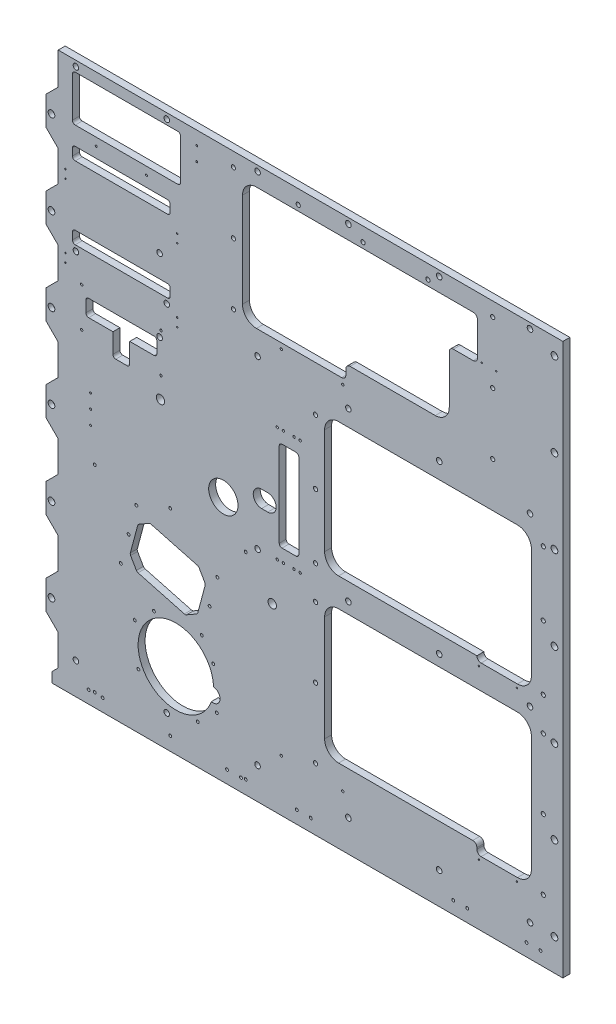
from build123d import *

# Parameters (mm, degrees)
SKETCH_1_W             = 1860
SKETCH_1_H             = 1973
SM_BASE_FLANGE_1_DEPTH = 25
CUT_EXTRUDE_2_DEPTH    = 1356.989398926
SKETCH_8_R             = 12
CUT_EXTRUDE_3_DEPTH    = 16
SKETCH_10_R            = 10
CUT_EXTRUDE_5_DEPTH    = 16
SKETCH_9_R             = 7
SKETCH_9_R_2           = 5.25
CUT_EXTRUDE_4_DEPTH    = 1356.989398926
SKETCH_11_R            = 7.5
SKETCH_11_R_2          = 3.4
SKETCH_11_R_3          = 10
SKETCH_11_R_4          = 2.55
SKETCH_11_R_5          = 4.25
SKETCH_11_R_6          = 15
SKETCH_11_R_7          = 5.15
SKETCH_11_R_8          = 52.5
SKETCH_11_W            = 387
SKETCH_11_H            = 164
SKETCH_11_W_2          = 350
SKETCH_11_H_2          = 45
SKETCH_11_W_3          = 70
SKETCH_11_H_3          = 322
CUT_EXTRUDE_6_DEPTH    = 1356.989398926
FILLET_1_R             = 10
FILLET_2_R             = 50
FILLET_3_R             = 15
FILLET_4_R             = 50
FILLET_5_R             = 15
FILLET_6_R             = 10
CHAMFER_1_SIZE         = 35
FILLET_7_R             = 10


# Sheet-metal steps are written as plain solids
with BuildPart() as part:
    # Sketch 1 → 基体-法兰1 (new body)
    with BuildSketch(Plane.XY):
        Rectangle(SKETCH_1_W, SKETCH_1_H)
    extrude(amount=-SM_BASE_FLANGE_1_DEPTH)

    # 草图6 → 切除-拉伸2 (cut, through all)
    with BuildSketch(Plane.XY):
        Polygon((-876, 871.5), (-919, 828.5), (-919, 724.5), (-876, 681.5), (-876, 571.5), (-919, 528.5), (-919, 424.5), (-876, 381.5), (-876, 271.5), (-919, 228.5), (-919, 124.5), (-876, 81.5), (-876, -28.5), (-919, -71.5), (-919, -175.5), (-876, -218.5), (-876, -328.5), (-919, -371.5), (-919, -475.5), (-876, -518.5), (-876, -628.5), (-919, -671.5), (-919, -775.5), (-876, -818.5), (-876, -928.5), (-897.5, -950), (-897.5, -986.5), (-930, -986.5), (-930, 986.5), (-876, 986.5), align=None)
    extrude(amount=-CUT_EXTRUDE_2_DEPTH, mode=Mode.SUBTRACT)

    # 草图8 → 切除-拉伸3 (cut)
    with BuildSketch(Plane.XY):
        with Locations((900, 926.5)):
            Circle(SKETCH_8_R)
        with Locations((900, 626.5)):
            Circle(SKETCH_8_R)
        with Locations((900, 326.5)):
            Circle(SKETCH_8_R)
        with Locations((900, 26.5)):
            Circle(SKETCH_8_R)
        with Locations((900, -273.5)):
            Circle(SKETCH_8_R)
        with Locations((900, -573.5)):
            Circle(SKETCH_8_R)
        with Locations((900, -873.5)):
            Circle(SKETCH_8_R)
        with Locations((-900, 776.5)):
            Circle(SKETCH_8_R)
        with Locations((-900, 476.5)):
            Circle(SKETCH_8_R)
        with Locations((-900, 176.5)):
            Circle(SKETCH_8_R)
        with Locations((-900, -123.5)):
            Circle(SKETCH_8_R)
        with Locations((-900, -423.5)):
            Circle(SKETCH_8_R)
        with Locations((-900, -723.5)):
            Circle(SKETCH_8_R)
    extrude(amount=-CUT_EXTRUDE_3_DEPTH, mode=Mode.SUBTRACT)

    # 草图10 → 切除-拉伸5 (cut)
    with BuildSketch(Plane.XY):
        with Locations((-812.5, 966.5)):
            Circle(SKETCH_10_R)
        with Locations((-487.5, 966.5)):
            Circle(SKETCH_10_R)
        with Locations((-162.5, 966.5)):
            Circle(SKETCH_10_R)
        with Locations((162.5, 966.5)):
            Circle(SKETCH_10_R)
        with Locations((487.5, 966.5)):
            Circle(SKETCH_10_R)
        with Locations((812.5, 966.5)):
            Circle(SKETCH_10_R)
        with Locations((-812.5, 394.5)):
            Circle(SKETCH_10_R)
        with Locations((487.5, 394.5)):
            Circle(SKETCH_10_R)
        with Locations((812.5, 394.5)):
            Circle(SKETCH_10_R)
        with Locations((162.5, 394.5)):
            Circle(SKETCH_10_R)
        with Locations((-162.5, 394.5)):
            Circle(SKETCH_10_R)
        with Locations((-487.5, 394.5)):
            Circle(SKETCH_10_R)
        with Locations((812.5, -203.5)):
            Circle(SKETCH_10_R)
        with Locations((487.5, -203.5)):
            Circle(SKETCH_10_R)
        with Locations((-162.5, -203.5)):
            Circle(SKETCH_10_R)
        with Locations((162.5, -203.5)):
            Circle(SKETCH_10_R)
        with Locations((812.5, -873.5)):
            Circle(SKETCH_10_R)
        with Locations((-487.5, -873.5)):
            Circle(SKETCH_10_R)
        with Locations((-812.5, -873.5)):
            Circle(SKETCH_10_R)
        with Locations((-162.5, -873.5)):
            Circle(SKETCH_10_R)
        with Locations((162.5, -873.5)):
            Circle(SKETCH_10_R)
        with Locations((487.5, -873.5)):
            Circle(SKETCH_10_R)
    extrude(amount=-CUT_EXTRUDE_5_DEPTH, mode=Mode.SUBTRACT)

    # 草图9 → 切除-拉伸4 (cut, through all)
    with BuildSketch(Plane.XY):
        with Locations((900, 926.5)):
            Circle(SKETCH_9_R)
        with Locations((900, 626.5)):
            Circle(SKETCH_9_R)
        with Locations((900, 326.5)):
            Circle(SKETCH_9_R)
        with Locations((900, 26.5)):
            Circle(SKETCH_9_R)
        with Locations((900, -273.5)):
            Circle(SKETCH_9_R)
        with Locations((900, -573.5)):
            Circle(SKETCH_9_R)
        with Locations((900, -873.5)):
            Circle(SKETCH_9_R)
        with Locations((-900, 776.5)):
            Circle(SKETCH_9_R)
        with Locations((-900, 476.5)):
            Circle(SKETCH_9_R)
        with Locations((-900, 176.5)):
            Circle(SKETCH_9_R)
        with Locations((-900, -123.5)):
            Circle(SKETCH_9_R)
        with Locations((-900, -423.5)):
            Circle(SKETCH_9_R)
        with Locations((-900, -723.5)):
            Circle(SKETCH_9_R)
        with Locations((812.5, 966.5)):
            Circle(SKETCH_9_R_2)
        with Locations((487.5, 966.5)):
            Circle(SKETCH_9_R_2)
        with Locations((162.5, 966.5)):
            Circle(SKETCH_9_R_2)
        with Locations((-162.5, 966.5)):
            Circle(SKETCH_9_R_2)
        with Locations((-487.5, 966.5)):
            Circle(SKETCH_9_R_2)
        with Locations((-812.5, 966.5)):
            Circle(SKETCH_9_R_2)
        with Locations((-812.5, 394.5)):
            Circle(SKETCH_9_R_2)
        with Locations((-487.5, 394.5)):
            Circle(SKETCH_9_R_2)
        with Locations((-162.5, 394.5)):
            Circle(SKETCH_9_R_2)
        with Locations((162.5, 394.5)):
            Circle(SKETCH_9_R_2)
        with Locations((487.5, 394.5)):
            Circle(SKETCH_9_R_2)
        with Locations((812.5, 394.5)):
            Circle(SKETCH_9_R_2)
        with Locations((812.5, -203.5)):
            Circle(SKETCH_9_R_2)
        with Locations((487.5, -203.5)):
            Circle(SKETCH_9_R_2)
        with Locations((162.5, -203.5)):
            Circle(SKETCH_9_R_2)
        with Locations((-162.5, -203.5)):
            Circle(SKETCH_9_R_2)
        with Locations((-812.5, -873.5)):
            Circle(SKETCH_9_R_2)
        with Locations((-487.5, -873.5)):
            Circle(SKETCH_9_R_2)
        with Locations((-162.5, -873.5)):
            Circle(SKETCH_9_R_2)
        with Locations((162.5, -873.5)):
            Circle(SKETCH_9_R_2)
        with Locations((487.5, -873.5)):
            Circle(SKETCH_9_R_2)
        with Locations((812.5, -873.5)):
            Circle(SKETCH_9_R_2)
    extrude(amount=-CUT_EXTRUDE_4_DEPTH, mode=Mode.SUBTRACT)

    # 草图11 → 切除-拉伸6 (cut, through all)
    with BuildSketch(Plane.XY):
        with Locations((-249, 936.5)):
            Circle(SKETCH_11_R)
        with Locations((-249, 716.5)):
            Circle(SKETCH_11_R)
        with Locations((-249, 496.5)):
            Circle(SKETCH_11_R)
        with Locations((-17, 936.5)):
            Circle(SKETCH_11_R)
        with Locations((215, 936.5)):
            Circle(SKETCH_11_R)
        with Locations((447, 936.5)):
            Circle(SKETCH_11_R)
        with Locations((679, 936.5)):
            Circle(SKETCH_11_R)
        with Locations((679, 716.5)):
            Circle(SKETCH_11_R)
        with Locations((679, 496.5)):
            Circle(SKETCH_11_R)
        with Locations((-380, 938.5)):
            Circle(SKETCH_11_R_2)
        with Locations((-380, 888.5)):
            Circle(SKETCH_11_R_2)
        with Locations((-740, 756.5)):
            Circle(SKETCH_11_R_2)
        with Locations(Location((-560, 756.5, 0), (0, 0, 180))):
            Circle(SKETCH_11_R_2)
        with Locations((-513, 538.5)):
            Circle(SKETCH_11_R_3)
        with Locations((-513, 278.5)):
            Circle(SKETCH_11_R_3)
        with Locations((-850, 630.5)):
            Circle(SKETCH_11_R_4)
        with Locations((-850, 600.5)):
            Circle(SKETCH_11_R_4)
        with Locations((-850, 370.5)):
            Circle(SKETCH_11_R_4)
        with Locations((-850, 340.5)):
            Circle(SKETCH_11_R_4)
        with Locations(Location((-450, 340.5, 0), (0, 0, 180))):
            Circle(SKETCH_11_R_4)
        with Locations(Location((-450, 370.5, 0), (0, 0, 180))):
            Circle(SKETCH_11_R_4)
        with Locations(Location((-450, 600.5, 0), (0, 0, 180))):
            Circle(SKETCH_11_R_4)
        with Locations(Location((-450, 630.5, 0), (0, 0, 180))):
            Circle(SKETCH_11_R_4)
        with Locations((-792, 301.5)):
            Circle(SKETCH_11_R_5)
        with Locations((-792, 161.5)):
            Circle(SKETCH_11_R_5)
        with Locations(Location((-508, 161.5, 0), (0, 0, 180))):
            Circle(SKETCH_11_R_5)
        with Locations(Location((-508, 301.5, 0), (0, 0, 180))):
            Circle(SKETCH_11_R_5)
        with Locations((-510, 86.5)):
            Circle(SKETCH_11_R_6)
        with Locations((-760, -18.5)):
            Circle(SKETCH_11_R_2)
        with Locations((-760, -68.5)):
            Circle(SKETCH_11_R_2)
        with Locations((-760, -118.5)):
            Circle(SKETCH_11_R_2)
        with Locations((639.5, 775)):
            Circle(SKETCH_11_R_4)
        with Locations((691.5, 775)):
            Circle(SKETCH_11_R_4)
        with Locations((45, 316.5)):
            Circle(SKETCH_11_R)
        with Locations((860, 316.5)):
            Circle(SKETCH_11_R)
        with Locations((860, 86.5)):
            Circle(SKETCH_11_R)
        with Locations((860, -263.5)):
            Circle(SKETCH_11_R)
        with Locations((45, 86.5)):
            Circle(SKETCH_11_R)
        with Locations((45, -263.5)):
            Circle(SKETCH_11_R)
        with Locations((45, -143.5)):
            Circle(SKETCH_11_R)
        with Locations((45, -763.5)):
            Circle(SKETCH_11_R)
        with Locations((45, -513.5)):
            Circle(SKETCH_11_R)
        with Locations((860, -143.5)):
            Circle(SKETCH_11_R)
        with Locations((860, -763.5)):
            Circle(SKETCH_11_R)
        with Locations((860, -513.5)):
            Circle(SKETCH_11_R)
        with Locations((-77.5, 458.5)):
            Circle(SKETCH_11_R_5)
        with Locations((142.5, 458.5)):
            Circle(SKETCH_11_R_5)
        with Locations((629.5, -170)):
            Circle(SKETCH_11_R_4)
        with Locations((765.5, -170)):
            Circle(SKETCH_11_R_4)
        with Locations((629.5, -770)):
            Circle(SKETCH_11_R_4)
        with Locations((765.5, -770)):
            Circle(SKETCH_11_R_4)
        with Locations((-717, -941.5)):
            Circle(SKETCH_11_R_7)
        with Locations((-767, -941.5)):
            Circle(SKETCH_11_R_7)
        with Locations((-272, -941.5)):
            Circle(SKETCH_11_R_7)
        with Locations((-222, -941.5)):
            Circle(SKETCH_11_R_7)
        with Locations((-22, -941.5)):
            Circle(SKETCH_11_R_7)
        with Locations((28, -941.5)):
            Circle(SKETCH_11_R_7)
        with Locations((800, -941.5)):
            Circle(SKETCH_11_R_7)
        with Locations((538, -941.5)):
            Circle(SKETCH_11_R_7)
        with Locations((588, -941.5)):
            Circle(SKETCH_11_R_7)
        with Locations((850, -941.5)):
            Circle(SKETCH_11_R_7)
        with Locations((142.5, -801.5)):
            Circle(SKETCH_11_R_5)
        with Locations((-77.5, -801.5)):
            Circle(SKETCH_11_R_5)
        with Locations((-92, 209.5)):
            Circle(SKETCH_11_R_5)
        with Locations((-70, 209.5)):
            Circle(SKETCH_11_R_5)
        with Locations((-32, 209.5)):
            Circle(SKETCH_11_R_5)
        with Locations((-10, 209.5)):
            Circle(SKETCH_11_R_5)
        with Locations((-92, -200.5)):
            Circle(SKETCH_11_R_5)
        with Locations((-70, -200.5)):
            Circle(SKETCH_11_R_5)
        with Locations((-10, -200.5)):
            Circle(SKETCH_11_R_5)
        with Locations((-32, -200.5)):
            Circle(SKETCH_11_R_5)
        with Locations((-110, -346.5)):
            Circle(SKETCH_11_R_6)
        with Locations((-745, -938.5)):
            Circle(SKETCH_11_R_7)
        with Locations((-475, -938.5)):
            Circle(SKETCH_11_R_7)
        with Locations((-205, -938.5)):
            Circle(SKETCH_11_R_7)
        with Locations((-745, -233.5)):
            Circle(SKETCH_11_R_7)
        with Locations((-475, -233.5)):
            Circle(SKETCH_11_R_7)
        with Locations((-205, -233.5)):
            Circle(SKETCH_11_R_7)
        with Locations((-285, -103.5)):
            Circle(SKETCH_11_R_8)
        with Locations((-533.428793543, -581.192878713)):
            Circle(SKETCH_11_R_7)
        with Locations((-601.783560853, -643.111177995)):
            Circle(SKETCH_11_R_7)
        with Locations((-589.07488824, -788.866931365)):
            Circle(SKETCH_11_R_7)
        with Locations(Location((-376.571206457, -845.807121287, 0), (0, 0, 180))):
            Circle(SKETCH_11_R_7)
        with Locations(Location((-320.92511176, -638.133068635, 0), (0, 0, 180))):
            Circle(SKETCH_11_R_7)
        with Locations((-596.169267315, -284.857050722)):
            Circle(SKETCH_11_R_7)
        with Locations((-306.391519428, -362.502764253)):
            Circle(SKETCH_11_R_7)
        with Locations(Location((-362.037614125, -570.176816905, 0), (0, 0, 180))):
            Circle(SKETCH_11_R_7)
        with Locations(Location((-651.815362012, -492.531103374, 0), (0, 0, 180))):
            Circle(SKETCH_11_R_7)
        with Locations((-334.214566777, -466.339790579)):
            Circle(SKETCH_11_R_7)
        with Locations((-623.992314664, -388.694077048)):
            Circle(SKETCH_11_R_7)
        with Locations((-308.216439147, -783.888822005)):
            Circle(SKETCH_11_R_7)
        Polygon((-523, 271.5), (-777, 271.5), (-777, 211.5), (-680, 211.5), (-680, 131.5), (-620, 131.5), (-620, 211.5), (-523, 211.5), align=None)
        with Locations((-631.5, 866.5)):
            Rectangle(SKETCH_11_W, SKETCH_11_H)
        with Locations((-650, 696)):
            Rectangle(SKETCH_11_W_2, SKETCH_11_H_2)
        with Locations((-650, 436)):
            Rectangle(SKETCH_11_W_2, SKETCH_11_H_2)
        Polygon((-216.5, 916.5), (624.5, 916.5), (624.5, 766.5), (523.5, 766.5), (523.5, 528.5), (153.5, 528.5), (153.5, 478.5), (-216.5, 478.5), align=None)
        Polygon((77.5, -141.5), (622.5, -141.5), (622.5, -156.5), (817.5, -156.5), (817.5, 336.5), (77.5, 336.5), align=None)
        Polygon((77.5, -243.5), (817.5, -243.5), (817.5, -756.5), (622.5, -756.5), (622.5, -721.5), (77.5, -721.5), align=None)
        with Locations((-50, 4.5)):
            Rectangle(SKETCH_11_W_3, SKETCH_11_H_3)
        with BuildLine():
            Line((-148, -10.5), (-126, -10.5))
            ThreePointArc((-126, -10.5), (-96, -40.5), (-126, -70.5))
            Line((-126, -70.5), (-148, -70.5))
            ThreePointArc((-148, -70.5), (-178, -40.5), (-148, -10.5))
        make_face()
        Polygon((-339.898627506, -371.64189486), (-581.380084079, -306.937133584), (-627.967512197, -480.803782316), (-386.486055625, -545.508543592), align=None)
        with BuildLine():
            ThreePointArc((-320.054328752, -709.67040324), (-588.33792598, -692.38134722), (-327.842450494, -758.842668687))
            ThreePointArc((-327.842450494, -758.842668687), (-296.969865505, -738.529514406), (-320.054328752, -709.67040324))
        make_face()
    extrude(amount=-CUT_EXTRUDE_6_DEPTH, mode=Mode.SUBTRACT)

    # 圆角1
    fillet_1_edges = [part.edges().sort_by_distance(p)[0] for p in [
        (-825, 784.5, -12.5),
        (-825, 948.5, -12.5),
        (-438, 948.5, -12.5),
        (-438, 784.5, -12.5),
        (-777, 211.5, -12.5),
        (-777, 271.5, -12.5),
        (-523, 271.5, -12.5),
        (-523, 211.5, -12.5),
        (-620, 131.5, -12.5),
        (-680, 131.5, -12.5),
        (-825, 413.5, -12.5),
        (-825, 458.5, -12.5),
        (-475, 458.5, -12.5),
        (-475, 413.5, -12.5),
        (-825, 673.5, -12.5),
        (-825, 718.5, -12.5),
        (-475, 718.5, -12.5),
        (-475, 673.5, -12.5),
    ]]
    fillet(fillet_1_edges, radius=FILLET_1_R)

    # 圆角2
    fillet_2_edges = [part.edges().sort_by_distance(p)[0] for p in [
        (-216.5, 478.5, -12.5),
        (-216.5, 916.5, -12.5),
        (523.5, 528.5, -12.5),
    ]]
    fillet(fillet_2_edges, radius=FILLET_2_R)

    # 圆角3
    fillet_3_edges = [part.edges().sort_by_distance(p)[0] for p in [
        (624.5, 916.5, -12.5),
        (624.5, 766.5, -12.5),
        (523.5, 766.5, -12.5),
        (153.5, 528.5, -12.5),
        (153.5, 478.5, -12.5),
    ]]
    fillet(fillet_3_edges, radius=FILLET_3_R)

    # 圆角4
    fillet_4_edges = [part.edges().sort_by_distance(p)[0] for p in [
        (77.5, -721.5, -12.5),
        (77.5, -243.5, -12.5),
        (817.5, -243.5, -12.5),
        (817.5, -756.5, -12.5),
        (77.5, -141.5, -12.5),
        (77.5, 336.5, -12.5),
        (817.5, 336.5, -12.5),
        (817.5, -156.5, -12.5),
    ]]
    fillet(fillet_4_edges, radius=FILLET_4_R)

    # 圆角5
    fillet_5_edges = [part.edges().sort_by_distance(p)[0] for p in [
        (622.5, -756.5, -12.5),
        (622.5, -721.5, -12.5),
        (622.5, -156.5, -12.5),
    ]]
    fillet(fillet_5_edges, radius=FILLET_5_R - 0.0001)  # a hair under: the kernel refuses the full size

    # 圆角6
    fillet_6_edges = [part.edges().sort_by_distance(p)[0] for p in [
        (-85, -156.5, -12.5),
        (-85, 165.5, -12.5),
        (-15, 165.5, -12.5),
        (-15, -156.5, -12.5),
    ]]
    fillet(fillet_6_edges, radius=FILLET_6_R)

    # 倒角1
    chamfer_1_edges = [part.edges().sort_by_distance(p)[0] for p in [
        (-627.967512197, -480.803782316, -12.5),
        (-581.380084079, -306.937133584, -12.5),
        (-339.898627506, -371.64189486, -12.5),
        (-386.486055625, -545.508543592, -12.5),
    ]]
    chamfer(chamfer_1_edges, length=CHAMFER_1_SIZE)

    # 圆角7
    fillet_7_edges = [part.edges().sort_by_distance(p)[0] for p in [
        (-618.908845618, -446.996378396, -12.5),
        (-590.438750657, -340.744537504, -12.5),
        (-373.706031426, -362.583228281, -12.5),
        (-547.572680158, -315.995800163, -12.5),
        (-420.293459545, -536.449877013, -12.5),
        (-594.160108277, -489.862448895, -12.5),
        (-348.957294085, -405.44929878, -12.5),
        (-377.427389046, -511.701139672, -12.5),
    ]]
    fillet(fillet_7_edges, radius=FILLET_7_R)


solid = part.part
